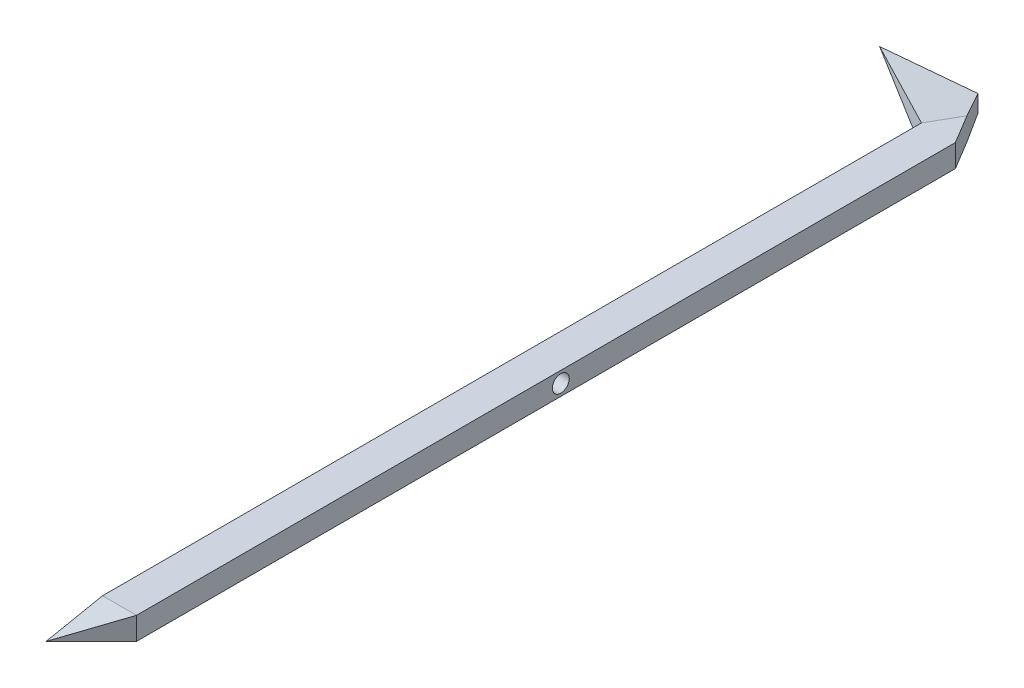
from build123d import *

# Parameters (mm, degrees)
BOSS_EXTRUDE1_DEPTH     = 5.08
CUT_EXTRUDE1_DEPTH      = 109.941018249
CUT_EXTRUDE1_DEPTH_BACK = 109.941018249
CUT_EXTRUDE2_DEPTH      = 185.574421805
CUT_EXTRUDE2_DEPTH_BACK = 185.574421805
SKETCH4_R               = 1.905
CUT_EXTRUDE3_DEPTH      = 21.336


with BuildPart() as part:
    # Sketch1 → Boss-Extrude1 (new body)
    with BuildSketch(Plane(origin=(0, 0, 0), x_dir=(1, 0, 0), z_dir=(0, 1, 0))):
        Polygon((7.62, 91.9861), (0, 104.6861), (-22.098, 104.6861), (0, 91.9861), (0, -104.6861), (7.62, -91.9861), align=None)
    extrude(amount=BOSS_EXTRUDE1_DEPTH)

    # Sketch2 → Cut-Extrude1 (cut, two sides: drawn at the far end of the back side and taken through both)
    with BuildSketch(Plane(origin=(7.62, 0, 0), x_dir=(0, 0, -1), z_dir=(1, 0, 0)).offset(-CUT_EXTRUDE1_DEPTH_BACK)):
        Polygon((-91.9861, 0), (-104.6861, 2.54), (-104.6861, 0), align=None)
        Polygon((-104.6861, 2.54), (-91.9861, 5.08), (-104.6861, 5.08), align=None)
    extrude(amount=CUT_EXTRUDE1_DEPTH + CUT_EXTRUDE1_DEPTH_BACK, mode=Mode.SUBTRACT)

    # Sketch3 → Cut-Extrude2 (cut, two sides: drawn at the far end of the back side and taken through both)
    with BuildSketch(Plane(origin=(39.73974923, 0, -69.147163661), x_dir=(0.867013943985018, 0, 0.4982838758534578), z_dir=(-0.4982838758534578, 0, 0.867013943985018)).offset(-CUT_EXTRUDE2_DEPTH_BACK)):
        Polygon((-45.835190433, 0), (-71.32266979, 2.54), (-71.32266979, 0), align=None)
        Polygon((-71.32266979, 2.54), (-45.835190433, 5.08), (-71.32266979, 5.08), align=None)
    extrude(amount=CUT_EXTRUDE2_DEPTH + CUT_EXTRUDE2_DEPTH_BACK, mode=Mode.SUBTRACT)

    # Sketch4 → Cut-Extrude3 (cut)
    with BuildSketch(Plane.ZY):
        with Locations((-3.3401, 2.54)):
            Circle(SKETCH4_R)
    extrude(amount=-CUT_EXTRUDE3_DEPTH, mode=Mode.SUBTRACT)


solid = part.part
